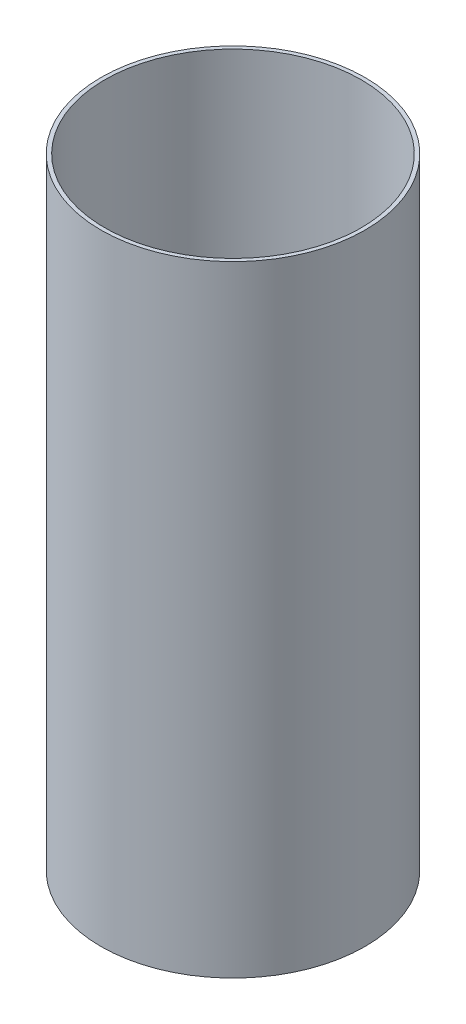
from build123d import *

# Parameters (mm, degrees)
SKETCH1_R           = 32.45
SKETCH1_R_2         = 31.5
BOSS_EXTRUDE1_DEPTH = 152.4


with BuildPart() as part:
    # Sketch1 → Boss-Extrude1 (new body)
    with BuildSketch(Plane(origin=(0, 0, 0), x_dir=(1, 0, 0), z_dir=(0, 1, 0))):
        Circle(SKETCH1_R)
        Circle(SKETCH1_R_2, mode=Mode.SUBTRACT)
    extrude(amount=BOSS_EXTRUDE1_DEPTH)


solid = part.part
